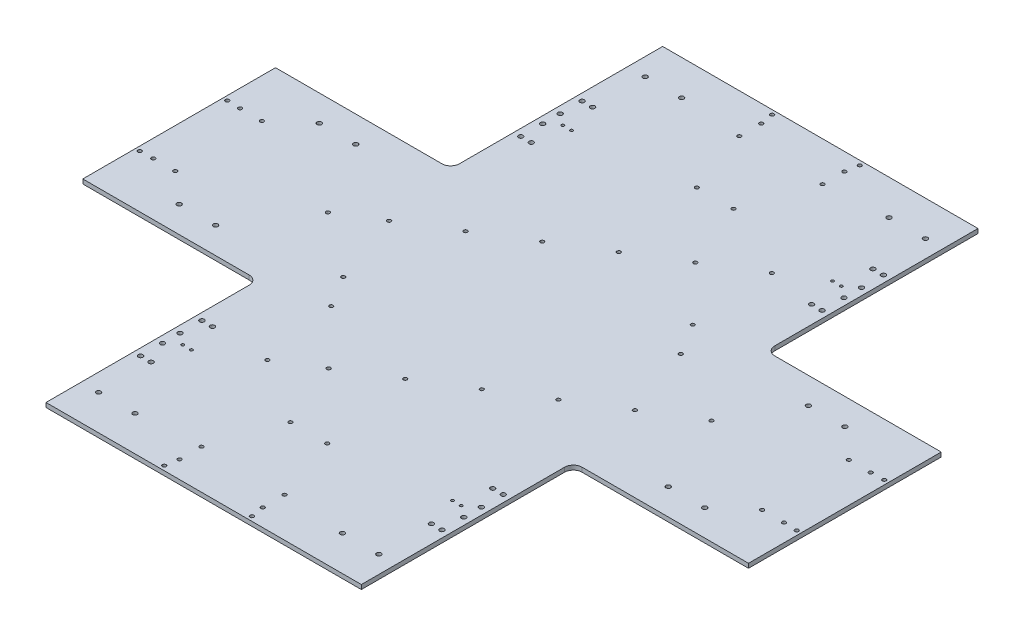
from build123d import *

# Parameters (mm, degrees)
BOSS_EXTRUDE1_DEPTH = 5
SKETCH2_R           = 2.125
CUT_EXTRUDE1_DEPTH  = 3
SKETCH4_R           = 2.6
SKETCH4_R_2         = 1.6
CUT_EXTRUDE3_DEPTH  = 10
SKETCH5_R           = 2.125
CUT_EXTRUDE4_DEPTH  = 10
FILLET1_R           = 10
SKETCH6_R           = 2.6
CUT_EXTRUDE5_DEPTH  = 10
SKETCH7_R           = 2.125
CUT_EXTRUDE6_DEPTH  = 10
SKETCH9_R           = 2.1
CUT_EXTRUDE7_DEPTH  = 10


with BuildPart() as part:
    # Sketch1 → Boss-Extrude1 (new body)
    with BuildSketch(Plane(origin=(0, 0, 0), x_dir=(1, 0, 0), z_dir=(0, 1, 0))):
        Polygon((180, 352), (-180, 352), (-180, 110), (-380, 110), (-380, -110), (-180, -110), (-180, -352), (180, -352), (180, -110), (380, -110), (380, 110), (180, 110), align=None)
    extrude(amount=BOSS_EXTRUDE1_DEPTH)

    # Sketch2 → Cut-Extrude1 (cut)
    with BuildSketch(Plane(origin=(0, 5, 0), x_dir=(1, 0, 0), z_dir=(0, 1, 0))):
        with Locations((360, 49.5)):
            Circle(SKETCH2_R)
        with Locations((335, 49.5)):
            Circle(SKETCH2_R)
        with Locations((335, -49.5)):
            Circle(SKETCH2_R)
        with Locations((360, -49.5)):
            Circle(SKETCH2_R)
        with Locations((-360, -49.5)):
            Circle(SKETCH2_R)
        with Locations((-335, -49.5)):
            Circle(SKETCH2_R)
        with Locations((-335, 49.5)):
            Circle(SKETCH2_R)
        with Locations((-360, 49.5)):
            Circle(SKETCH2_R)
        with Locations((47.5, 332)):
            Circle(SKETCH2_R)
        with Locations((47.5, 307)):
            Circle(SKETCH2_R)
        with Locations((-47.5, 307)):
            Circle(SKETCH2_R)
        with Locations((-47.5, 332)):
            Circle(SKETCH2_R)
        with Locations((-47.5, -332)):
            Circle(SKETCH2_R)
        with Locations((-47.5, -307)):
            Circle(SKETCH2_R)
        with Locations((47.5, -307)):
            Circle(SKETCH2_R)
        with Locations((47.5, -332)):
            Circle(SKETCH2_R)
    extrude(amount=-CUT_EXTRUDE1_DEPTH, mode=Mode.SUBTRACT)

    # Sketch4 → Cut-Extrude3 (cut)
    with BuildSketch(Plane(origin=(0, 5, 0), x_dir=(1, 0, 0), z_dir=(0, 1, 0))):
        with Locations((-172, 182)):
            Circle(SKETCH4_R)
        with Locations((-160, 182)):
            Circle(SKETCH4_R)
        with Locations((-172, 207)):
            Circle(SKETCH4_R)
        with Locations((-172, 227)):
            Circle(SKETCH4_R)
        with Locations((-172, 252)):
            Circle(SKETCH4_R)
        with Locations((-160, 252)):
            Circle(SKETCH4_R)
        with Locations((160, 252)):
            Circle(SKETCH4_R)
        with Locations((172, 252)):
            Circle(SKETCH4_R)
        with Locations((172, 227)):
            Circle(SKETCH4_R)
        with Locations((172, 207)):
            Circle(SKETCH4_R)
        with Locations((160, 182)):
            Circle(SKETCH4_R)
        with Locations((172, 182)):
            Circle(SKETCH4_R)
        with Locations((172, -182)):
            Circle(SKETCH4_R)
        with Locations((160, -182)):
            Circle(SKETCH4_R)
        with Locations((172, -207)):
            Circle(SKETCH4_R)
        with Locations((172, -227)):
            Circle(SKETCH4_R)
        with Locations((172, -252)):
            Circle(SKETCH4_R)
        with Locations((160, -252)):
            Circle(SKETCH4_R)
        with Locations((-160, -252)):
            Circle(SKETCH4_R)
        with Locations((-172, -252)):
            Circle(SKETCH4_R)
        with Locations((-172, -227)):
            Circle(SKETCH4_R)
        with Locations((-172, -207)):
            Circle(SKETCH4_R)
        with Locations((-160, -182)):
            Circle(SKETCH4_R)
        with Locations((-172, -182)):
            Circle(SKETCH4_R)
        with Locations((159, -217)):
            Circle(SKETCH4_R_2)
        with Locations((-159, -217)):
            Circle(SKETCH4_R_2)
        with Locations((159, 217)):
            Circle(SKETCH4_R_2)
        with Locations((-159, 217)):
            Circle(SKETCH4_R_2)
        with Locations((149, -217)):
            Circle(SKETCH4_R_2)
        with Locations((-149, -217)):
            Circle(SKETCH4_R_2)
        with Locations((149, 217)):
            Circle(SKETCH4_R_2)
        with Locations((-149, 217)):
            Circle(SKETCH4_R_2)
    extrude(amount=-CUT_EXTRUDE3_DEPTH, mode=Mode.SUBTRACT)

    # Sketch5 → Cut-Extrude4 (cut)
    with BuildSketch(Plane(origin=(0, 5, 0), x_dir=(1, 0, 0), z_dir=(0, 1, 0))):
        with Locations((-50, 347)):
            Circle(SKETCH5_R)
        with Locations((50, 347)):
            Circle(SKETCH5_R)
        with Locations((50, -347)):
            Circle(SKETCH5_R)
        with Locations((-50, -347)):
            Circle(SKETCH5_R)
        with Locations((-375, 50)):
            Circle(SKETCH5_R)
        with Locations((-375, -50)):
            Circle(SKETCH5_R)
        with Locations((375, -50)):
            Circle(SKETCH5_R)
        with Locations((375, 50)):
            Circle(SKETCH5_R)
    extrude(amount=-CUT_EXTRUDE4_DEPTH, mode=Mode.SUBTRACT)

    # Fillet1
    fillet1_edges = [part.edges().sort_by_distance(p)[0] for p in [
        (-180, 2.5, -110),
        (-180, 2.5, 110),
        (180, 2.5, 110),
        (180, 2.5, -110),
    ]]
    fillet(fillet1_edges, radius=FILLET1_R)

    # Sketch6 → Cut-Extrude5 (cut)
    with BuildSketch(Plane(origin=(0, 5, 0), x_dir=(1, 0, 0), z_dir=(0, 1, 0))):
        with Locations((-160, 312)):
            Circle(SKETCH6_R)
        with Locations((-118.4, 312)):
            Circle(SKETCH6_R)
        with Locations((118.4, 312)):
            Circle(SKETCH6_R)
        with Locations((160, 312)):
            Circle(SKETCH6_R)
        with Locations((160, -312)):
            Circle(SKETCH6_R)
        with Locations((118.4, -312)):
            Circle(SKETCH6_R)
        with Locations((-118.4, -312)):
            Circle(SKETCH6_R)
        with Locations((-160, -312)):
            Circle(SKETCH6_R)
        with Locations((258.4, 80)):
            Circle(SKETCH6_R)
        with Locations((300, 80)):
            Circle(SKETCH6_R)
        with Locations((300, -80)):
            Circle(SKETCH6_R)
        with Locations((258.4, -80)):
            Circle(SKETCH6_R)
        with Locations((-258.4, -80)):
            Circle(SKETCH6_R)
        with Locations((-300, -80)):
            Circle(SKETCH6_R)
        with Locations((-300, 80)):
            Circle(SKETCH6_R)
        with Locations((-258.4, 80)):
            Circle(SKETCH6_R)
    extrude(amount=-CUT_EXTRUDE5_DEPTH, mode=Mode.SUBTRACT)

    # Sketch7 → Cut-Extrude6 (cut)
    with BuildSketch(Plane(origin=(0, 5, 0), x_dir=(1, 0, 0), z_dir=(0, 1, 0))):
        with Locations((-55.682048102, 90.197059371)):
            Circle(SKETCH7_R)
        with Locations((-1.648904044, 123.553757998)):
            Circle(SKETCH7_R)
        with Locations((52.384240013, 156.910456625)):
            Circle(SKETCH7_R)
        with Locations((106.41738407, 190.267155252)):
            Circle(SKETCH7_R)
        with Locations((-109.715192159, 56.840360744)):
            Circle(SKETCH7_R)
        with Locations((-163.748336216, 23.483662117)):
            Circle(SKETCH7_R)
        with Locations((-206.974851462, -3.201696784)):
            Circle(SKETCH7_R)
        with Locations((-95.610755259, -183.595815527)):
            Circle(SKETCH7_R)
        with Locations((-52.384240013, -156.910456625)):
            Circle(SKETCH7_R)
        with Locations((1.648904044, -123.553757998)):
            Circle(SKETCH7_R)
        with Locations((217.781480273, 9.87303651)):
            Circle(SKETCH7_R)
        with Locations((163.748336216, -23.483662117)):
            Circle(SKETCH7_R)
        with Locations((109.715192159, -56.840360744)):
            Circle(SKETCH7_R)
        with Locations((55.682048102, -90.197059371)):
            Circle(SKETCH7_R)
    extrude(amount=-CUT_EXTRUDE6_DEPTH, mode=Mode.SUBTRACT)

    # Sketch9 → Cut-Extrude7 (cut)
    with BuildSketch(Plane(origin=(0, 5, 0), x_dir=(1, 0, 0), z_dir=(0, 1, 0))):
        with Locations((-134.396185529, -58.288539604)):
            Circle(SKETCH9_R)
        with Locations((-112.333487225, -94.026997091)):
            Circle(SKETCH9_R)
        with Locations((112.333487225, 94.026997091)):
            Circle(SKETCH9_R)
        with Locations((134.396185529, 58.288539604)):
            Circle(SKETCH9_R)
        with Locations((21, 232)):
            Circle(SKETCH9_R)
        with Locations((-21, 232)):
            Circle(SKETCH9_R)
        with Locations((-21, -232)):
            Circle(SKETCH9_R)
        with Locations((21, -232)):
            Circle(SKETCH9_R)
    extrude(amount=-CUT_EXTRUDE7_DEPTH, mode=Mode.SUBTRACT)


solid = part.part
